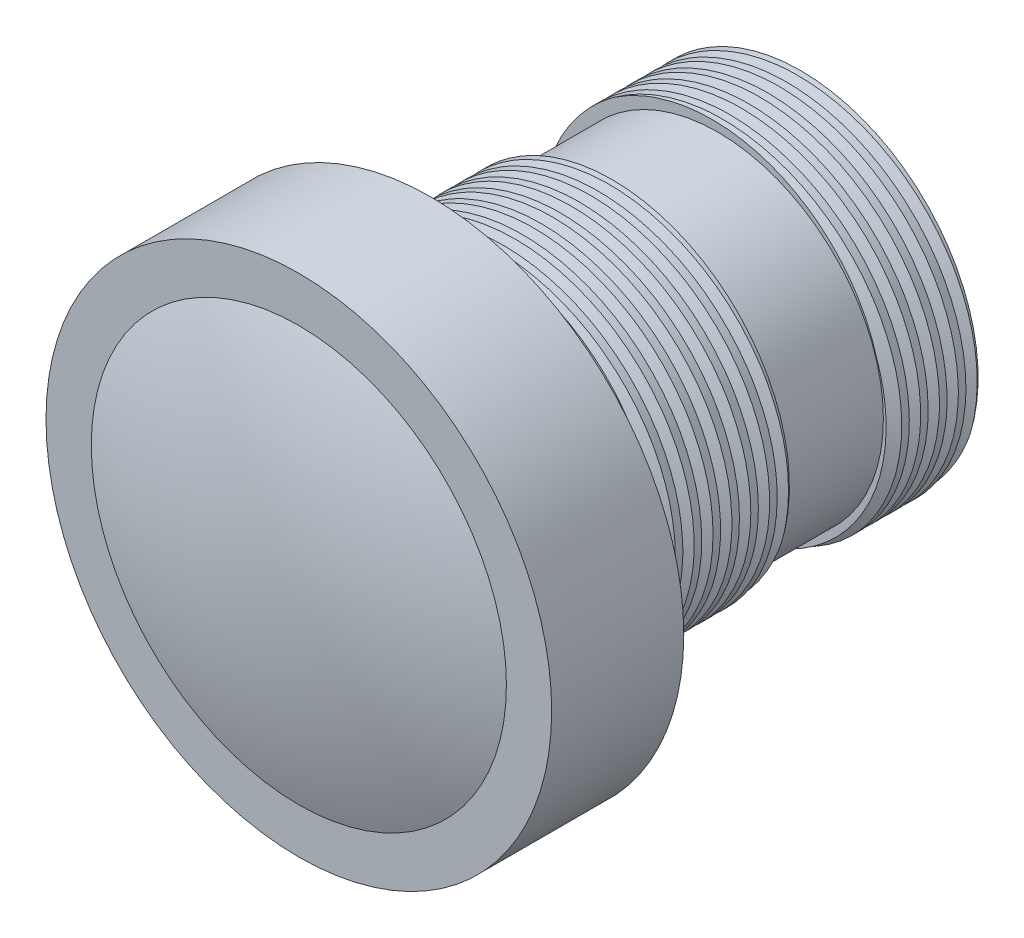
from build123d import *

# Parameters (mm, degrees)
SKETCH1_R           = 5.969
BOSS_EXTRUDE1_DEPTH = 2.794
SKETCH2_R           = 5.5753
BOSS_EXTRUDE2_DEPTH = 9.652
BOSS_EXTRUDE3_START = -6.35
SKETCH3_R           = 5.969
BOSS_EXTRUDE3_DEPTH = 4.064
CUT_SWEEP2_PITCH    = 0.635
SKETCH6_R           = 2.667
CUT_EXTRUDE1_DEPTH  = 16.038644899
SKETCH7_R           = 8.509
SKETCH7_R_2         = 2.667
BOSS_EXTRUDE4_DEPTH = 4.445
SKETCH8_R           = 6.985
CUT_EXTRUDE2_DEPTH  = 0.508


with BuildPart() as part:
    # Sketch1 → Boss-Extrude1 (new body)
    with BuildSketch(Plane.XY):
        Circle(SKETCH1_R)
    extrude(amount=BOSS_EXTRUDE1_DEPTH)

    # Sketch2 → Boss-Extrude2 (add)
    with BuildSketch(Plane.XY.offset(2.794)):
        Circle(SKETCH2_R)
    extrude(amount=BOSS_EXTRUDE2_DEPTH)

    # Sketch3 → Boss-Extrude3 (add)
    with BuildSketch(Plane(origin=(0, 0, 0), x_dir=(-1, 0, 0), z_dir=(0, 0, -1)).offset(BOSS_EXTRUDE3_START)):
        with Locations(Location((0, 0, 0), (0, 0, 180))):
            Circle(SKETCH3_R)
    extrude(amount=-BOSS_EXTRUDE3_DEPTH)

    # Cut-Sweep2: the profile of Sketch5 screwed along a right-hand helix of 20.75 turns, 6 arcs to a turn; built about Z, then put on its axis
    cut_sweep2_z = Axis((0, 0, 0), (0, 0, 1))
    cut_sweep2_corners = [(5.6007, 0, 0), (5.969, 0, -0.1905), (6.922972935, 0, -0.1905), (6.922972935, 0, 0.1905), (5.969, 0, 0.1905)]
    with BuildLine(mode=Mode.PRIVATE) as cut_sweep2_profile:
        Line(cut_sweep2_corners[0], cut_sweep2_corners[1])
        Line(cut_sweep2_corners[1], cut_sweep2_corners[2])
        Line(cut_sweep2_corners[2], cut_sweep2_corners[3])
        Line(cut_sweep2_corners[3], cut_sweep2_corners[4])
        Line(cut_sweep2_corners[4], cut_sweep2_corners[0])
    cut_sweep2_cap = Face(cut_sweep2_profile.wire())
    cut_sweep2_turn_angles = [0, 30, 60, 90, 120, 150, 180, 210, 240, 270, 300, 330, 360]
    cut_sweep2_turn_weights = [1, 0.8660254037844387, 1, 0.8660254037844387, 1, 0.8660254037844387, 1, 0.8660254037844387, 1, 0.8660254037844387, 1, 0.8660254037844387, 1]
    cut_sweep2_turn_rails = [Edge.make_bspline([Vector(p[0], p[1], 0).rotate(cut_sweep2_z, cut_sweep2_turn_angles[k]) / cut_sweep2_turn_weights[k] + Vector(0, 0, p[2] + CUT_SWEEP2_PITCH * cut_sweep2_turn_angles[k] / 360) for k in range(13)], [0, 0, 0, 1, 1, 2, 2, 3, 3, 4, 4, 5, 5, 6, 6, 6], 2, cut_sweep2_turn_weights) for p in cut_sweep2_corners]
    cut_sweep2_turn_sides = [Face.make_surface_from_curves(cut_sweep2_turn_rails[p[0]], cut_sweep2_turn_rails[p[1]]) for p in [(0, 1), (1, 2), (2, 3), (3, 4), (4, 0)]]
    cut_sweep2_last_angles = [7200, 7230, 7260, 7290, 7320, 7350, 7380, 7410, 7440, 7455, 7470]
    cut_sweep2_last_weights = [1, 0.8660254037844387, 1, 0.8660254037844387, 1, 0.8660254037844387, 1, 0.8660254037844387, 1, 0.9659258262889224, 1]
    cut_sweep2_last_rails = [Edge.make_bspline([Vector(p[0], p[1], 0).rotate(cut_sweep2_z, cut_sweep2_last_angles[k]) / cut_sweep2_last_weights[k] + Vector(0, 0, p[2] + CUT_SWEEP2_PITCH * cut_sweep2_last_angles[k] / 360) for k in range(11)], [0, 0, 0, 1, 1, 2, 2, 3, 3, 4, 4, 5, 5, 5], 2, cut_sweep2_last_weights) for p in cut_sweep2_corners]
    cut_sweep2_last_sides = [Face.make_surface_from_curves(cut_sweep2_last_rails[p[0]], cut_sweep2_last_rails[p[1]]) for p in [(0, 1), (1, 2), (2, 3), (3, 4), (4, 0)]]
    cut_sweep2 = Plane(origin=(0, 0, 12.446), x_dir=(0, 1, 0), z_dir=(0, 0, -1)) * Solid(Shell([*[p.moved(Location((0, 0, CUT_SWEEP2_PITCH * i))) for i in range(20) for p in cut_sweep2_turn_sides], *cut_sweep2_last_sides, cut_sweep2_cap, cut_sweep2_cap.rotate(cut_sweep2_z, 7470).moved(Location((0, 0, CUT_SWEEP2_PITCH * 7470 / 360)))]))
    add(cut_sweep2, mode=Mode.SUBTRACT)

    # Sketch6 → Cut-Extrude1 (cut, through all)
    with BuildSketch(Plane(origin=(0, 0, 0), x_dir=(-1, 0, 0), z_dir=(0, 0, -1))):
        Circle(SKETCH6_R)
    extrude(amount=-CUT_EXTRUDE1_DEPTH, mode=Mode.SUBTRACT)

    # Sketch7 → Boss-Extrude4 (add)
    with BuildSketch(Plane.XY.offset(12.446)):
        Circle(SKETCH7_R)
        with Locations(Location((0, 0, 0), (0, 0, 180))):
            Circle(SKETCH7_R_2, mode=Mode.SUBTRACT)
    extrude(amount=BOSS_EXTRUDE4_DEPTH)

    # Sketch8 → Cut-Extrude2 (cut)
    with BuildSketch(Plane.XY.offset(16.891)):
        Circle(SKETCH8_R)
    extrude(amount=-CUT_EXTRUDE2_DEPTH, mode=Mode.SUBTRACT)


with BuildPart() as body_2:
    # Sketch9 → Revolve1 (revolve)
    with BuildSketch(Plane(origin=(0, 0, 0), x_dir=(0, 0, -1), z_dir=(1, 0, 0)), mode=Mode.PRIVATE) as revolve1_sk:
        with BuildLine():
            Line((-16.891, 6.985), (-13.501370273, 6.985))
            Line((-13.501370273, 6.985), (-13.501370273, 0))
            Line((-13.501370273, 0), (-18.161, 0))
            ThreePointArc((-18.161, 0), (-17.840918529, 3.549757914), (-16.891, 6.985))
        make_face()
    revolve(revolve1_sk.sketch.rotate(Axis((0, 0, 13.501370273), (0, 0, 1)), 90), axis=Axis((0, 0, 13.501370273), (0, 0, 1)))


solid = Compound([part.part, body_2.part])
